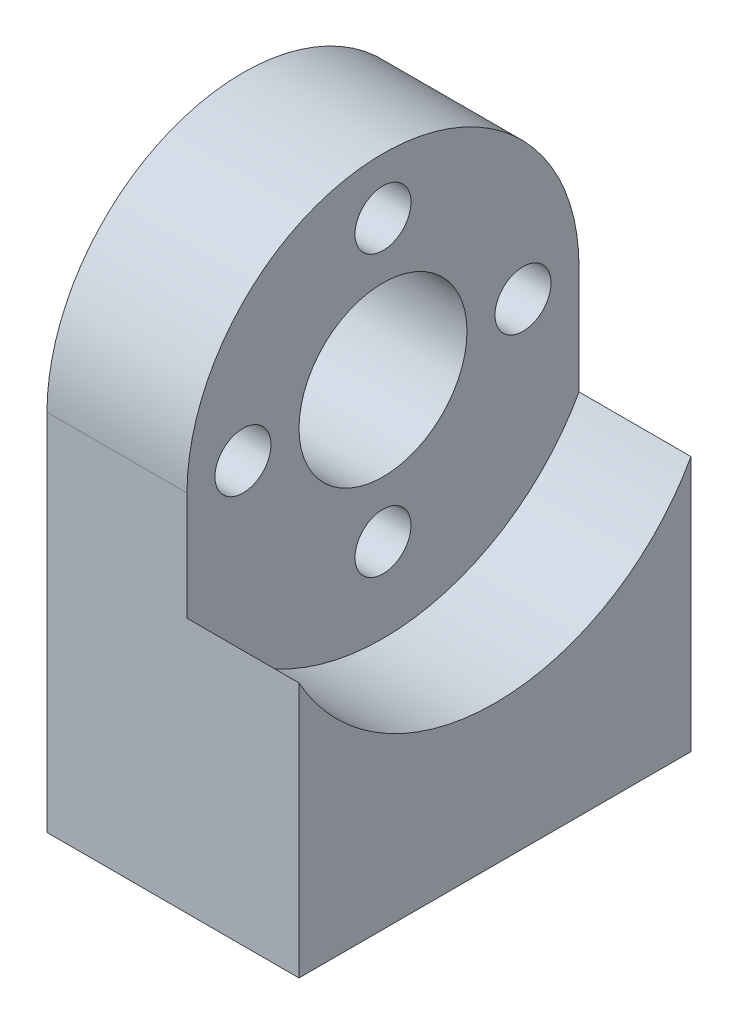
from build123d import *

# Parameters (mm, degrees)
SKETCH1_R                       = 3
SKETCH1_R_2                     = 1
BOSS_EXTRUDE1_DEPTH             = 9
SKETCH2_R                       = 8
CUT_EXTRUDE1_DEPTH              = 4
CIRPATTERN1_OUTLINE_R           = 1
CIRPATTERN1_DEPTH               = 5
TAP_DRILL_FOR_M3X0_5_TAP1_D     = 2.5
TAP_DRILL_FOR_M3X0_5_TAP1_DEPTH = 4
TAP_DRILL_FOR_M3X0_5_TAP1_TIP   = 0.751075774
SKETCH5_R                       = 1
CUT_EXTRUDE2_DEPTH              = 4
CHAMFER1_SIZE                   = 1


# Read off the part's stored shape, not the designer's step: CirPattern1
with BuildPart() as part:
    # Sketch1 → Boss-Extrude1 (new body)
    with BuildSketch(Plane(origin=(0, 0, 0), x_dir=(0, 0, -1), z_dir=(1, 0, 0))):
        with BuildLine():
            Line((0, 13), (0, 0))
            Line((0, 0), (14, 0))
            Line((14, 0), (14, 13))
            ThreePointArc((14, 13), (7, 20), (0, 13))
        make_face()
        with Locations((7, 13)):
            Circle(SKETCH1_R, mode=Mode.SUBTRACT)
        with Locations((12, 13)):
            Circle(SKETCH1_R_2, mode=Mode.SUBTRACT)
    extrude(amount=BOSS_EXTRUDE1_DEPTH)

    # Sketch2 → Cut-Extrude1 (cut)
    with BuildSketch(Plane(origin=(9, 0, 0), x_dir=(0, 0, -1), z_dir=(1, 0, 0))):
        with Locations((7, 13)):
            Circle(SKETCH2_R)
    extrude(amount=-CUT_EXTRUDE1_DEPTH, mode=Mode.SUBTRACT)

    # CirPattern1 outline → CirPattern1 (cut)
    with BuildSketch(Plane.YZ):
        with Locations((8, -7)):
            Circle(CIRPATTERN1_OUTLINE_R)
        with Locations((13, -2)):
            Circle(CIRPATTERN1_OUTLINE_R)
        with Locations((18, -7)):
            Circle(CIRPATTERN1_OUTLINE_R)
    extrude(amount=CIRPATTERN1_DEPTH, mode=Mode.SUBTRACT)

    # Tap Drill for M3x0.5 Tap1
    with Locations(Plane(origin=(0, 0, 0), x_dir=(-1, 0, 0), z_dir=(0, -1, 0))):
        with Locations((-3, 11), (-7, 3)):
            Hole(TAP_DRILL_FOR_M3X0_5_TAP1_D / 2, depth=TAP_DRILL_FOR_M3X0_5_TAP1_DEPTH)
            with Locations((0, 0, -(TAP_DRILL_FOR_M3X0_5_TAP1_DEPTH + TAP_DRILL_FOR_M3X0_5_TAP1_TIP / 2))):  # 118° drill point
                Cone(0, TAP_DRILL_FOR_M3X0_5_TAP1_D / 2, TAP_DRILL_FOR_M3X0_5_TAP1_TIP, mode=Mode.SUBTRACT)

    # Sketch5 → Cut-Extrude2 (cut)
    with BuildSketch(Plane.XZ):
        with Locations(Location((3, -3, 0), (0, 0, 270))):
            Circle(SKETCH5_R)
        with Locations(Location((7, -11, 0), (0, 0, 270))):
            Circle(SKETCH5_R)
    extrude(amount=-CUT_EXTRUDE2_DEPTH, mode=Mode.SUBTRACT)

    # Chamfer1
    chamfer1_edges = [part.edges().sort_by_distance(p)[0] for p in [
        (0, 13, -11),
        (0, 17, -7),
        (0, 12, -2),
        (0, 7, -7),
    ]]
    chamfer(chamfer1_edges, length=CHAMFER1_SIZE - 0.0001)  # a hair under: the kernel refuses the full size


solid = part.part
